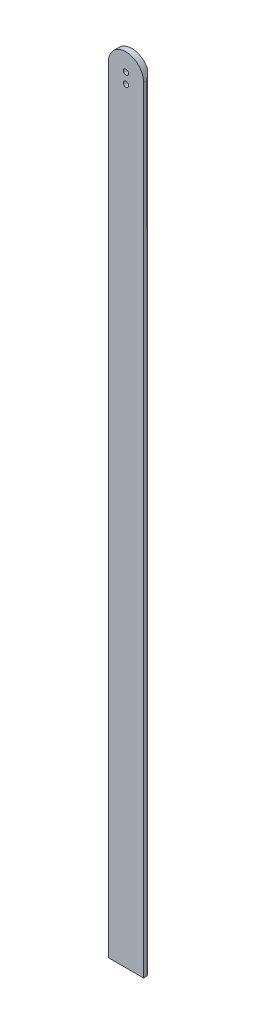
from build123d import *

# Parameters (mm, degrees)
BOSS_EXTRUDE1_DEPTH = 431.8
SKETCH4_W           = 15.875
SKETCH4_H           = 25.4
CUT_EXTRUDE1_DEPTH  = 6.35
SKETCH5_W           = 1.5875
SKETCH5_H           = 25.4
CUT_EXTRUDE2_DEPTH  = 6.35
SKETCH6_R           = 1.4224
CUT_EXTRUDE3_DEPTH  = 5.08
CUT_EXTRUDE4_START  = -2.54
CUT_EXTRUDE4_DEPTH  = 2.54
SKETCH8_R           = 1.4224
CUT_EXTRUDE5_DEPTH  = 5.08
CUT_EXTRUDE7_DEPTH  = 5.08


with BuildPart() as part:
    # Sketch2 → Boss-Extrude1 (new body)
    with BuildSketch(Plane(origin=(0, 0, 0), x_dir=(1, 0, 0), z_dir=(0, 1, 0))):
        with BuildLine():
            Line((0, 0), (19.05, 0))
            Line((19.05, 0), (19.05, 1.5875))
            ThreePointArc((19.05, 1.5875), (18.585032015, 2.710032015), (17.4625, 3.175))
            Line((17.4625, 3.175), (4.7625, 3.175))
            ThreePointArc((4.7625, 3.175), (3.639967985, 3.639967985), (3.175, 4.7625))
            Line((3.175, 4.7625), (3.175, 17.4625))
            ThreePointArc((3.175, 17.4625), (2.710032015, 18.585032015), (1.5875, 19.05))
            Line((1.5875, 19.05), (0, 19.05))
            Line((0, 19.05), (0, 0))
        make_face()
    extrude(amount=BOSS_EXTRUDE1_DEPTH)

    # Sketch4 → Cut-Extrude1 (cut)
    with BuildSketch(Plane(origin=(3.175, 0, 0), x_dir=(0, 0, -1), z_dir=(1, 0, 0))):
        with Locations((11.1125, 419.1)):
            Rectangle(SKETCH4_W, SKETCH4_H)
    extrude(amount=-CUT_EXTRUDE1_DEPTH, mode=Mode.SUBTRACT)

    # Sketch5 → Cut-Extrude2 (cut)
    with BuildSketch(Plane.ZY.offset(-3.175)):
        with Locations((-3.96875, 419.1)):
            Rectangle(SKETCH5_W, SKETCH5_H)
    extrude(amount=-CUT_EXTRUDE2_DEPTH, mode=Mode.SUBTRACT)

    # Sketch6 → Cut-Extrude3 (cut)
    with BuildSketch(Plane(origin=(3.175, 0, 0), x_dir=(0, 0, -1), z_dir=(1, 0, 0))):
        with Locations((11.1125, 109.5375)):
            Circle(SKETCH6_R)
        with Locations((11.1125, 203.2)):
            Circle(SKETCH6_R)
        with Locations((11.1125, 296.8625)):
            Circle(SKETCH6_R)
        with Locations((11.1125, 11.1125)):
            Circle(SKETCH6_R)
        with Locations((11.1125, 395.2875)):
            Circle(SKETCH6_R)
    extrude(amount=-CUT_EXTRUDE3_DEPTH, mode=Mode.SUBTRACT)

    # Sketch7 → Cut-Extrude4 (cut)
    with BuildSketch(Plane(origin=(0, 431.8, 0), x_dir=(1, 0, 0), z_dir=(0, 1, 0)).offset(CUT_EXTRUDE4_START)):
        with BuildLine():
            Line((17.4625, 3.175), (0, 3.175))
            Line((0, 3.175), (0, 0))
            Line((0, 0), (19.05, 0))
            Line((19.05, 0), (19.05, 1.5875))
            ThreePointArc((19.05, 1.5875), (18.585032015, 2.710032015), (17.4625, 3.175))
        make_face()
    extrude(amount=CUT_EXTRUDE4_DEPTH, mode=Mode.SUBTRACT)

    # Sketch8 → Cut-Extrude5 (cut)
    with BuildSketch(Plane(origin=(0, 0, -3.175), x_dir=(-1, 0, 0), z_dir=(0, 0, -1))):
        with Locations((-9.525, 419.735)):
            Circle(SKETCH8_R)
        with Locations((-9.525, 414.02)):
            Circle(SKETCH8_R)
    extrude(amount=-CUT_EXTRUDE5_DEPTH, mode=Mode.SUBTRACT)

    # Sketch10 → Cut-Extrude7 (cut)
    with BuildSketch(Plane(origin=(0, 0, -3.175), x_dir=(-1, 0, 0), z_dir=(0, 0, -1))):
        with BuildLine():
            ThreePointArc((-9.525, 429.26), (-2.789807909, 426.470192091), (0, 419.735))
            Line((0, 419.735), (0, 429.26))
            Line((0, 429.26), (-9.525, 429.26))
        make_face()
        with BuildLine():
            Line((-9.525, 429.26), (-19.05, 429.26))
            Line((-19.05, 429.26), (-19.05, 419.735))
            ThreePointArc((-19.05, 419.735), (-16.260192091, 426.470192091), (-9.525, 429.26))
        make_face()
    extrude(amount=-CUT_EXTRUDE7_DEPTH, mode=Mode.SUBTRACT)


solid = part.part
